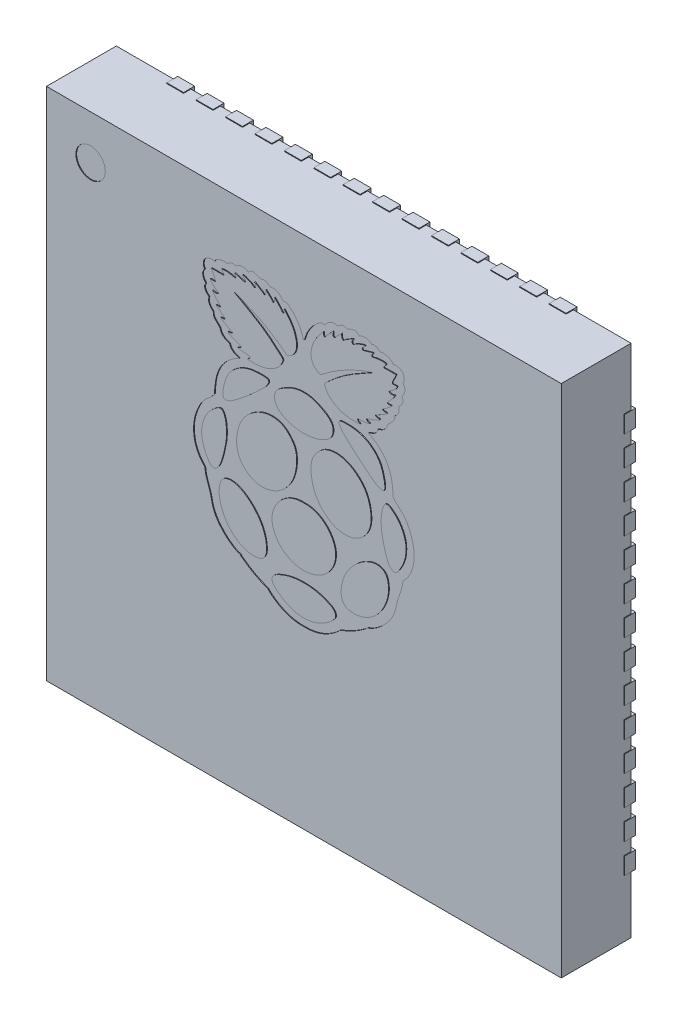
from build123d import *

# Parameters (mm, degrees)
SKETCH1_W                 = 7
SKETCH1_H                 = 7
BOSS_EXTRUDE1_DEPTH       = 1
SKETCH1_4_W               = 7
SKETCH1_4_H               = 7
CUT_EXTRUDE1_DEPTH        = 0.05
WRAP1_START               = -0.01
WRAP1_OUTLINE_R           = 0.2
WRAP1_DEPTH               = 0.01
BOSS_EXTRUDE2_DEPTH       = 0.15
LPATTERN1_COUNT           = 14
LPATTERN1_PITCH           = 0.4
CIRPATTERN1_COUNT         = 4
CIRPATTERN1_COPY_1_DEPTH  = 0.15
CIRPATTERN1_COPY_2_DEPTH  = 0.15
CIRPATTERN1_COPY_3_DEPTH  = 0.15
CIRPATTERN1_COPY_4_DEPTH  = 0.15
CIRPATTERN1_COPY_5_DEPTH  = 0.15
CIRPATTERN1_COPY_6_DEPTH  = 0.15
CIRPATTERN1_COPY_7_DEPTH  = 0.15
CIRPATTERN1_COPY_8_DEPTH  = 0.15
CIRPATTERN1_COPY_9_DEPTH  = 0.15
CIRPATTERN1_COPY_10_DEPTH = 0.15
CIRPATTERN1_COPY_11_DEPTH = 0.15
CIRPATTERN1_COPY_12_DEPTH = 0.15
CIRPATTERN1_COPY_13_DEPTH = 0.15
CIRPATTERN1_COPY_14_DEPTH = 0.15
CIRPATTERN1_COPY_15_DEPTH = 0.15
CIRPATTERN1_COPY_16_DEPTH = 0.15
CIRPATTERN1_COPY_17_DEPTH = 0.15
CIRPATTERN1_COPY_18_DEPTH = 0.15
CIRPATTERN1_COPY_19_DEPTH = 0.15
CIRPATTERN1_COPY_20_DEPTH = 0.15
CIRPATTERN1_COPY_21_DEPTH = 0.15
CIRPATTERN1_COPY_22_DEPTH = 0.15
CIRPATTERN1_COPY_23_DEPTH = 0.15
CIRPATTERN1_COPY_24_DEPTH = 0.15
CIRPATTERN1_COPY_25_DEPTH = 0.15
CIRPATTERN1_COPY_26_DEPTH = 0.15
CIRPATTERN1_COPY_27_DEPTH = 0.15
CIRPATTERN1_COPY_28_DEPTH = 0.15
CIRPATTERN1_COPY_29_DEPTH = 0.15
CIRPATTERN1_COPY_30_DEPTH = 0.15
CIRPATTERN1_COPY_31_DEPTH = 0.15
CIRPATTERN1_COPY_32_DEPTH = 0.15
CIRPATTERN1_COPY_33_DEPTH = 0.15
CIRPATTERN1_COPY_34_DEPTH = 0.15
CIRPATTERN1_COPY_35_DEPTH = 0.15
CIRPATTERN1_COPY_36_DEPTH = 0.15
CIRPATTERN1_COPY_37_DEPTH = 0.15
CIRPATTERN1_COPY_38_DEPTH = 0.15
CIRPATTERN1_COPY_39_DEPTH = 0.15
BOSS_EXTRUDE3_DEPTH       = 0.05


# Read off the part's stored shape, not the designer's step: Wrap1
with BuildPart() as part:
    # Sketch1 → Boss-Extrude1 (new body)
    with BuildSketch(Plane.XY):
        Rectangle(SKETCH1_W, SKETCH1_H)
    extrude(amount=BOSS_EXTRUDE1_DEPTH)

    # Sketch1<4> → Cut-Extrude1 (cut)
    with BuildSketch(Plane.XY):
        Rectangle(SKETCH1_4_W, SKETCH1_4_H)
    extrude(amount=CUT_EXTRUDE1_DEPTH, mode=Mode.SUBTRACT)

    # Wrap1 outline → Wrap1 (cut)
    # profile 1 of 2: a face of its own
    with BuildSketch(Plane.XY.offset(1).offset(WRAP1_START)):
        with BuildLine():
            add(Edge.make_bspline(
                [(0, 2.263868394), (-0.000237821, 2.263988796), (-0.009075366, 2.264963574), (-0.012945677, 2.28180384), (-0.043625306, 2.395157437), (-0.141319772, 2.512017758), (-0.13635276, 2.504435025), (-0.194166588, 2.561981979), (-0.233115268, 2.582744886), (-0.254894364, 2.58781046), (-0.283447361, 2.579723211), (-0.293929284, 2.5974559), (-0.31048703, 2.61570591), (-0.318377963, 2.622126585), (-0.336821248, 2.640155859), (-0.361566116, 2.652541494), (-0.376583272, 2.658425788), (-0.395633183, 2.665798558), (-0.437797963, 2.664301581), (-0.440118612, 2.655192025), (-0.46921817, 2.665395191), (-0.479871951, 2.675708489), (-0.506284686, 2.693046871), (-0.535137006, 2.701340793), (-0.552129951, 2.699103027), (-0.567212348, 2.694821527), (-0.588210152, 2.688184658), (-0.61004655, 2.692240757), (-0.62842033, 2.707072221), (-0.652301945, 2.714789305), (-0.678770517, 2.71653393), (-0.693501407, 2.728138313), (-0.726188853, 2.710078323), (-0.745292698, 2.698269963), (-0.752604228, 2.684685375), (-0.770149642, 2.695516983), (-0.810781494, 2.712947906), (-0.828036794, 2.703946281), (-0.85279431, 2.711390266), (-0.890559096, 2.697736765), (-0.914571037, 2.681870808), (-0.921221254, 2.670832962), (-0.930681967, 2.675154966), (-0.937185658, 2.678638895), (-0.956793571, 2.681497479), (-0.988116752, 2.676099863), (-0.997350133, 2.67222525), (-1.021303652, 2.659987036), (-1.033745867, 2.642860774), (-1.052131869, 2.642115595), (-1.056733903, 2.645030417), (-1.064601481, 2.650757521), (-1.083547885, 2.647087463), (-1.103091742, 2.643858941), (-1.097155115, 2.646252489), (-1.136597298, 2.640489907), (-1.172528357, 2.624140858), (-1.200178438, 2.609970685), (-1.207197282, 2.594434597), (-1.213154387, 2.583404699), (-1.238801596, 2.590329305), (-1.28222102, 2.586424918), (-1.301636295, 2.578293763), (-1.327857828, 2.566095655), (-1.343257887, 2.552083748), (-1.359766555, 2.524660663), (-1.366104219, 2.502070233), (-1.36431879, 2.44462577), (-1.348865083, 2.429221336), (-1.350245079, 2.418236266), (-1.357634287, 2.409247222), (-1.367167479, 2.396088075), (-1.374797688, 2.374813102), (-1.376525098, 2.356914978), (-1.366771465, 2.31177959), (-1.357485344, 2.300382973), (-1.346172354, 2.281629438), (-1.330566569, 2.257185809), (-1.348107151, 2.242939318), (-1.352151795, 2.21647816), (-1.338024847, 2.177158458), (-1.316561423, 2.151881982), (-1.30254943, 2.139409346), (-1.29370493, 2.12966458), (-1.286252195, 2.123872757), (-1.291466811, 2.126272952), (-1.295003854, 2.088943824), (-1.291953479, 2.047360608), (-1.270765122, 2.017155092), (-1.236508115, 1.983768537), (-1.226111926, 1.982695351), (-1.233977647, 1.956044911), (-1.219907274, 1.91651789), (-1.205121975, 1.901729915), (-1.178689977, 1.874945904), (-1.137299812, 1.836663638), (-1.134297422, 1.815497868), (-1.124236292, 1.791543277), (-1.11779475, 1.782106183), (-1.097387248, 1.758374331), (-1.078314913, 1.746418462), (-1.070348233, 1.739864174), (-1.029792354, 1.722048335), (-1.012002743, 1.718649509), (-1.006781202, 1.713616191), (-1.001472674, 1.695337281), (-0.998493799, 1.686055382), (-0.987667188, 1.670565142), (-0.974088499, 1.653934889), (-0.94971148, 1.637270374), (-0.91086471, 1.621705284), (-0.903709179, 1.621199235), (-0.874006313, 1.609522827), (-0.949686956, 1.569589166), (-1.016293053, 1.520040427), (-1.058917183, 1.476174679), (-1.101231651, 1.430363577), (-1.131260362, 1.383400135), (-1.182267256, 1.278676023), (-1.201028818, 1.197588845), (-1.214007102, 1.059972921), (-1.209853934, 1.026067695), (-1.231089628, 0.995630059), (-1.274155722, 0.947912237), (-1.369743629, 0.878205197), (-1.44921421, 0.731968927), (-1.529296604, 0.47465884), (-1.475757946, 0.219780431), (-1.343913741, 0.096978345), (-1.337606042, -0.020245899), (-1.275116309, -0.126690919), (-1.250841145, -0.284953623), (-1.208023351, -0.405498638), (-1.10133956, -0.544820872), (-0.985019233, -0.641505904), (-0.899837205, -0.684446239), (-0.869205377, -0.691176819), (-0.851618912, -0.712118946), (-0.81854871, -0.73491996), (-0.769330282, -0.769927336), (-0.69196638, -0.820673366), (-0.600677542, -0.866842882), (-0.523466343, -0.898110105), (-0.489651838, -0.910697507), (-0.449757183, -0.954747695), (-0.390921249, -0.997054094), (-0.297990262, -1.05213429), (-0.179031081, -1.102092447), (-0.068764025, -1.115463523), (0, -1.112662139)],
                knots=[0, 0, 0, 0, 0.001900291, 0.002584691, 0.003843042, 0.023580722, 0.036045596, 0.052346293, 0.057185764, 0.061235409, 0.063231459, 0.064667643, 0.066784773, 0.069273202, 0.072185191, 0.075187351, 0.078809585, 0.082400045, 0.086051364, 0.08888384, 0.090784678, 0.094268595, 0.098665045, 0.102667824, 0.105704606, 0.108516071, 0.111229292, 0.112119566, 0.115681304, 0.120110402, 0.12274182, 0.12592397, 0.128115227, 0.131986193, 0.135578493, 0.136847986, 0.142481505, 0.146435775, 0.150468854, 0.152042347, 0.157607107, 0.160024983, 0.160368889, 0.162208965, 0.167306561, 0.169261352, 0.171845021, 0.174864158, 0.177676096, 0.179020491, 0.181965713, 0.184813575, 0.185526527, 0.18601189, 0.189206279, 0.190796332, 0.192248095, 0.195217366, 0.20478082, 0.205221654, 0.205437557, 0.206626447, 0.211935744, 0.21619854, 0.22472088, 0.232451198, 0.238461167, 0.241117898, 0.24157737, 0.242225607, 0.243733091, 0.245473461, 0.247613706, 0.251185055, 0.256063659, 0.263766058, 0.266039767, 0.266486209, 0.268360127, 0.274247011, 0.279659646, 0.283762891, 0.286861923, 0.287819324, 0.288866577, 0.296294981, 0.29959124, 0.302294002, 0.310760701, 0.311266772, 0.31166935, 0.314016333, 0.317561091, 0.325031272, 0.331992342, 0.335112927, 0.338819169, 0.342140221, 0.345247144, 0.347815807, 0.351550013, 0.357123841, 0.359317349, 0.360959262, 0.362099574, 0.363390464, 0.36569942, 0.368940794, 0.372518092, 0.377094444, 0.381031411, 0.385193158, 0.386224874, 0.387467602, 0.39393445, 0.407282794, 0.411458552, 0.432999424, 0.442172302, 0.494014449, 0.501132878, 0.506876327, 0.51030105, 0.518847019, 0.538922233, 0.567744448, 0.598820024, 0.672572958, 0.678783832, 0.683964663, 0.728334155, 0.738200334, 0.76285999, 0.790528128, 0.824028352, 0.836268966, 0.837918239, 0.838903934, 0.849482332, 0.857732907, 0.868746728, 0.895186067, 0.9078897, 0.910243551, 0.91271422, 0.936762579, 0.945908598, 0.966070072, 1, 1, 1, 1], degree=3))
            add(Edge.make_bspline(
                [(0, -1.112662139), (0.068764025, -1.115463523), (0.179031081, -1.102092447), (0.297990262, -1.05213429), (0.390921249, -0.997054094), (0.449757183, -0.954747695), (0.489651838, -0.910697507), (0.523466343, -0.898110105), (0.600677542, -0.866842882), (0.69196638, -0.820673366), (0.769330282, -0.769927336), (0.81854871, -0.73491996), (0.851618912, -0.712118946), (0.869205377, -0.691176819), (0.899837205, -0.684446239), (0.985019233, -0.641505904), (1.10133956, -0.544820872), (1.208023351, -0.405498638), (1.250841145, -0.284953623), (1.275116309, -0.126690919), (1.337606042, -0.020245899), (1.343913741, 0.096978345), (1.475757946, 0.219780431), (1.529296604, 0.47465884), (1.44921421, 0.731968927), (1.369743629, 0.878205197), (1.274155722, 0.947912237), (1.231089628, 0.995630059), (1.209853934, 1.026067695), (1.214007102, 1.059972921), (1.201028818, 1.197588845), (1.182267256, 1.278676023), (1.131260362, 1.383400135), (1.101231651, 1.430363577), (1.058917183, 1.476174679), (1.016293053, 1.520040427), (0.949686956, 1.569589166), (0.874006313, 1.609522827), (0.903709179, 1.621199235), (0.91086471, 1.621705284), (0.94971148, 1.637270374), (0.974088499, 1.653934889), (0.987667188, 1.670565142), (0.998493799, 1.686055382), (1.001472674, 1.695337281), (1.006781202, 1.713616191), (1.012002743, 1.718649509), (1.029792354, 1.722048335), (1.070348233, 1.739864174), (1.078314913, 1.746418462), (1.097387248, 1.758374331), (1.11779475, 1.782106183), (1.124236292, 1.791543277), (1.134297422, 1.815497868), (1.137299812, 1.836663638), (1.178689977, 1.874945904), (1.205121975, 1.901729915), (1.219907274, 1.91651789), (1.233977647, 1.956044911), (1.226111926, 1.982695351), (1.236508115, 1.983768537), (1.270765122, 2.017155092), (1.291953479, 2.047360608), (1.295003854, 2.088943824), (1.291466811, 2.126272952), (1.286252195, 2.123872757), (1.29370493, 2.12966458), (1.30254943, 2.139409346), (1.316561423, 2.151881982), (1.338024847, 2.177158458), (1.352151795, 2.21647816), (1.348107151, 2.242939318), (1.330566569, 2.257185809), (1.346172354, 2.281629438), (1.357485344, 2.300382973), (1.366771465, 2.31177959), (1.376525098, 2.356914978), (1.374797688, 2.374813102), (1.367167479, 2.396088075), (1.357634287, 2.409247222), (1.350245079, 2.418236266), (1.348865083, 2.429221336), (1.36431879, 2.44462577), (1.366104219, 2.502070233), (1.359766555, 2.524660663), (1.343257887, 2.552083748), (1.327857828, 2.566095655), (1.301636295, 2.578293763), (1.28222102, 2.586424918), (1.238801596, 2.590329305), (1.213154387, 2.583404699), (1.207197282, 2.594434597), (1.200178438, 2.609970685), (1.172528357, 2.624140858), (1.136597298, 2.640489907), (1.097155115, 2.646252489), (1.103091742, 2.643858941), (1.083547885, 2.647087463), (1.064601481, 2.650757521), (1.056733903, 2.645030417), (1.052131869, 2.642115595), (1.033745867, 2.642860774), (1.021303652, 2.659987036), (0.997350133, 2.67222525), (0.988116752, 2.676099863), (0.956793571, 2.681497479), (0.937185658, 2.678638895), (0.930681967, 2.675154966), (0.921221254, 2.670832962), (0.914571037, 2.681870808), (0.890559096, 2.697736765), (0.85279431, 2.711390266), (0.828036794, 2.703946281), (0.810781494, 2.712947906), (0.770149642, 2.695516983), (0.752604228, 2.684685375), (0.745292698, 2.698269963), (0.726188853, 2.710078323), (0.693501407, 2.728138313), (0.678770517, 2.71653393), (0.652301945, 2.714789305), (0.62842033, 2.707072221), (0.61004655, 2.692240757), (0.588210152, 2.688184658), (0.567212348, 2.694821527), (0.552129951, 2.699103027), (0.535137006, 2.701340793), (0.506284686, 2.693046871), (0.479871951, 2.675708489), (0.46921817, 2.665395191), (0.440118612, 2.655192025), (0.437797963, 2.664301581), (0.395633183, 2.665798558), (0.376583272, 2.658425788), (0.361566116, 2.652541494), (0.336821248, 2.640155859), (0.318377963, 2.622126585), (0.31048703, 2.61570591), (0.293929284, 2.5974559), (0.283447361, 2.579723211), (0.254894364, 2.58781046), (0.233115268, 2.582744886), (0.194166588, 2.561981979), (0.13635276, 2.504435025), (0.141319772, 2.512017758), (0.043625306, 2.395157437), (0.012945677, 2.28180384), (0.009075366, 2.264963574), (0.000237821, 2.263988796), (0, 2.263868394)],
                knots=[0, 0, 0, 0, 0.033929928, 0.054091402, 0.063237421, 0.08728578, 0.089756449, 0.0921103, 0.104813933, 0.131253272, 0.142267093, 0.150517668, 0.161096066, 0.162081761, 0.163731034, 0.175971648, 0.209471872, 0.23714001, 0.261799666, 0.271665845, 0.316035337, 0.321216168, 0.327427042, 0.401179976, 0.432255552, 0.461077767, 0.481152981, 0.48969895, 0.493123673, 0.498867122, 0.505985551, 0.557827698, 0.567000576, 0.588541448, 0.592717206, 0.60606555, 0.612532398, 0.613775126, 0.614806842, 0.618968589, 0.622905556, 0.627481908, 0.631059206, 0.63430058, 0.636609536, 0.637900426, 0.639040738, 0.640682651, 0.642876159, 0.648449987, 0.652184193, 0.654752856, 0.657859779, 0.661180831, 0.664887073, 0.668007658, 0.674968728, 0.682438909, 0.685983667, 0.68833065, 0.688733228, 0.689239299, 0.697705998, 0.70040876, 0.703705019, 0.711133423, 0.712180676, 0.713138077, 0.716237109, 0.720340354, 0.725752989, 0.731639873, 0.733513791, 0.733960233, 0.736233942, 0.743936341, 0.748814945, 0.752386294, 0.754526539, 0.756266909, 0.757774393, 0.75842263, 0.758882102, 0.761538833, 0.767548802, 0.77527912, 0.78380146, 0.788064256, 0.793373553, 0.794562443, 0.794778346, 0.79521918, 0.804782634, 0.807751905, 0.809203668, 0.810793721, 0.81398811, 0.814473473, 0.815186425, 0.818034287, 0.820979509, 0.822323904, 0.825135842, 0.828154979, 0.830738648, 0.832693439, 0.837791035, 0.839631111, 0.839975017, 0.842392893, 0.847957653, 0.849531146, 0.853564225, 0.857518495, 0.863152014, 0.864421507, 0.868013807, 0.871884773, 0.87407603, 0.87725818, 0.879889598, 0.884318696, 0.887880434, 0.888770708, 0.891483929, 0.894295394, 0.897332176, 0.901334955, 0.905731405, 0.909215322, 0.91111616, 0.913948636, 0.917599955, 0.921190415, 0.924812649, 0.927814809, 0.930726798, 0.933215227, 0.935332357, 0.936768541, 0.938764591, 0.942814236, 0.947653707, 0.963954404, 0.976419278, 0.996156958, 0.997415309, 0.998099709, 1, 1, 1, 1], degree=3))
        make_face()
        with BuildLine():
            add(Edge.make_bspline(
                [(-0.531515197, -0.297651942), (-0.543543432, -0.259370555), (-0.577069278, -0.180388075), (-0.644693864, -0.08734762), (-0.736792822, 0.007103231), (-0.833159448, 0.076500682), (-0.94667835, 0.115276878), (-1.035916644, 0.117375088), (-1.122992708, 0.070195823), (-1.148251718, -0.019622291), (-1.15810035, -0.147581539), (-1.114748121, -0.30421543), (-1.003778414, -0.485896724), (-0.846609353, -0.594051168), (-0.703306569, -0.623044086), (-0.619776045, -0.614682235), (-0.553226147, -0.592734366), (-0.508924854, -0.525176289), (-0.502324523, -0.420627754), (-0.517434866, -0.342464385), (-0.531515197, -0.297651942)],
                knots=[0, 0, 0, 0, 0.055870822, 0.118870956, 0.159068405, 0.239979588, 0.28134836, 0.325123552, 0.361044344, 0.410312217, 0.445863072, 0.541403845, 0.629333197, 0.739921879, 0.795425324, 0.829580463, 0.856809559, 0.889825811, 0.934597249, 1, 1, 1, 1], degree=3))
        make_face(mode=Mode.SUBTRACT)
        with BuildLine():
            add(Edge.make_bspline(
                [(-1.090644048, 0.377522908), (-1.074285401, 0.442659223), (-1.044609409, 0.577932361), (-1.050086185, 0.747860906), (-1.081829502, 0.850889106), (-1.113561365, 0.895223877), (-1.15616414, 0.891370436), (-1.201737491, 0.859280938), (-1.26585247, 0.807947611), (-1.333820533, 0.715057545), (-1.393600733, 0.575123927), (-1.392718807, 0.38848051), (-1.329323494, 0.243275776), (-1.263990479, 0.148500489), (-1.213772928, 0.142598533), (-1.167925828, 0.171235832), (-1.123266572, 0.254570264), (-1.102057885, 0.332075674), (-1.090644048, 0.377522908)],
                knots=[0, 0, 0, 0, 0.116420494, 0.239674936, 0.286793958, 0.305267853, 0.326896757, 0.351294306, 0.402423018, 0.468070765, 0.54858081, 0.663133905, 0.775877559, 0.831292747, 0.840399115, 0.860618206, 0.918770515, 1, 1, 1, 1], degree=3))
        make_face(mode=Mode.SUBTRACT)
        with BuildLine():
            add(Edge.make_bspline(
                [(0, -1.012050226), (0.089927248, -1.014001512), (0.233370228, -0.967301928), (0.369735263, -0.871531667), (0.44209674, -0.789964282), (0.419201952, -0.71075274), (0.263079789, -0.624901123), (0.121360151, -0.59567764), (0, -0.596815113)],
                knots=[0, 0, 0, 0, 0.267268042, 0.421318846, 0.517025164, 0.544466299, 0.654200027, 1, 1, 1, 1], degree=3))
            add(Edge.make_bspline(
                [(0, -0.596815113), (-0.121360151, -0.59567764), (-0.263079789, -0.624901123), (-0.419201952, -0.71075274), (-0.44209674, -0.789964282), (-0.369735263, -0.871531667), (-0.233370228, -0.967301928), (-0.089927248, -1.014001512), (0, -1.012050226)],
                knots=[0, 0, 0, 0, 0.345799973, 0.455533701, 0.482974836, 0.578681154, 0.732731958, 1, 1, 1, 1], degree=3))
        make_face(mode=Mode.SUBTRACT)
        with BuildLine():
            add(Edge.make_bspline(
                [(0.531515197, -0.297651942), (0.517434866, -0.342464385), (0.502324523, -0.420627754), (0.508924854, -0.525176289), (0.553226147, -0.592734366), (0.619776045, -0.614682235), (0.703306569, -0.623044086), (0.846609353, -0.594051168), (1.003778414, -0.485896724), (1.114748121, -0.30421543), (1.15810035, -0.147581539), (1.148251718, -0.019622291), (1.122992708, 0.070195823), (1.035916644, 0.117375088), (0.94667835, 0.115276878), (0.833159448, 0.076500682), (0.736792822, 0.007103231), (0.644693864, -0.08734762), (0.577069278, -0.180388075), (0.543543432, -0.259370555), (0.531515197, -0.297651942)],
                knots=[0, 0, 0, 0, 0.065402751, 0.110174189, 0.143190441, 0.170419537, 0.204574676, 0.260078121, 0.370666803, 0.458596155, 0.554136928, 0.589687783, 0.638955656, 0.674876448, 0.71865164, 0.760020412, 0.840931595, 0.881129044, 0.944129178, 1, 1, 1, 1], degree=3))
        make_face(mode=Mode.SUBTRACT)
        with BuildLine():
            add(Edge.make_bspline(
                [(0, -0.455059026), (0.08979737, -0.451289117), (0.251268571, -0.406059257), (0.402043296, -0.234605961), (0.450037987, -0.045757123), (0.394941445, 0.129131806), (0.25379809, 0.295477961), (0.097752415, 0.34952134), (0, 0.342542534)],
                knots=[0, 0, 0, 0, 0.209548183, 0.368426031, 0.50683945, 0.64131966, 0.776300843, 1, 1, 1, 1], degree=3))
            add(Edge.make_bspline(
                [(0, 0.342542534), (-0.097752415, 0.34952134), (-0.25379809, 0.295477961), (-0.394941445, 0.129131806), (-0.450037987, -0.045757123), (-0.402043296, -0.234605961), (-0.251268571, -0.406059257), (-0.08979737, -0.451289117), (0, -0.455059026)],
                knots=[0, 0, 0, 0, 0.223699157, 0.35868034, 0.49316055, 0.631573969, 0.790451817, 1, 1, 1, 1], degree=3))
        make_face(mode=Mode.SUBTRACT)
        with BuildLine():
            add(Edge.make_bspline(
                [(-0.189095095, 1.036344232), (-0.209503755, 1.059477517), (-0.264926623, 1.113521864), (-0.395651543, 1.157600049), (-0.55707909, 1.139226168), (-0.722141769, 1.051324575), (-0.852066054, 0.908115969), (-0.918901369, 0.70148681), (-0.920967041, 0.468479656), (-0.764922036, 0.290643703), (-0.56764745, 0.235435321), (-0.334382369, 0.290792952), (-0.140347201, 0.498242107), (-0.089530282, 0.741516294), (-0.104374902, 0.924859525), (-0.159118674, 1.002365857), (-0.189095095, 1.036344232)],
                knots=[0, 0, 0, 0, 0.034249796, 0.086381331, 0.148490656, 0.211762113, 0.293385027, 0.358085361, 0.453756871, 0.540429687, 0.601769765, 0.676182365, 0.798958217, 0.89645744, 0.949693595, 1, 1, 1, 1], degree=3))
        make_face(mode=Mode.SUBTRACT)
        with BuildLine():
            add(Edge.make_bspline(
                [(0.189095095, 1.036344232), (0.159118674, 1.002365857), (0.104374902, 0.924859525), (0.089530282, 0.741516294), (0.140347201, 0.498242107), (0.334382369, 0.290792952), (0.56764745, 0.235435321), (0.764922036, 0.290643703), (0.920967041, 0.468479656), (0.918901369, 0.70148681), (0.852066054, 0.908115969), (0.722141769, 1.051324575), (0.55707909, 1.139226168), (0.395651543, 1.157600049), (0.264926623, 1.113521864), (0.209503755, 1.059477517), (0.189095095, 1.036344232)],
                knots=[0, 0, 0, 0, 0.050306405, 0.10354256, 0.201041783, 0.323817635, 0.398230235, 0.459570313, 0.546243129, 0.641914639, 0.706614973, 0.788237887, 0.851509344, 0.913618669, 0.965750204, 1, 1, 1, 1], degree=3))
        make_face(mode=Mode.SUBTRACT)
        with BuildLine():
            add(Edge.make_bspline(
                [(1.090644048, 0.377522908), (1.102057885, 0.332075674), (1.123266572, 0.254570264), (1.167925828, 0.171235832), (1.213772928, 0.142598533), (1.263990479, 0.148500489), (1.329323494, 0.243275776), (1.392718807, 0.38848051), (1.393600733, 0.575123927), (1.333820533, 0.715057545), (1.26585247, 0.807947611), (1.201737491, 0.859280938), (1.15616414, 0.891370436), (1.113561365, 0.895223877), (1.081829502, 0.850889106), (1.050086185, 0.747860906), (1.044609409, 0.577932361), (1.074285401, 0.442659223), (1.090644048, 0.377522908)],
                knots=[0, 0, 0, 0, 0.081229485, 0.139381794, 0.159600885, 0.168707253, 0.224122441, 0.336866095, 0.45141919, 0.531929235, 0.597576982, 0.648705694, 0.673103243, 0.694732147, 0.713206042, 0.760325064, 0.883579506, 1, 1, 1, 1], degree=3))
        make_face(mode=Mode.SUBTRACT)
        with BuildLine():
            add(Edge.make_bspline(
                [(-0.611758378, 1.564830674), (-0.662943254, 1.563253399), (-0.778843652, 1.549146371), (-0.927915521, 1.471020224), (-1.025989636, 1.360701447), (-1.070285808, 1.254530862), (-1.091617805, 1.17041437), (-1.102179575, 1.097775036), (-1.103092218, 1.045494493), (-1.078490928, 1.027025591), (-1.056452718, 1.027650636), (-0.999778322, 1.040812446), (-0.820055853, 1.173910603), (-0.642597265, 1.327527411), (-0.490244112, 1.481164618), (-0.47442421, 1.532396424), (-0.4826459, 1.554624881), (-0.515524541, 1.563044511), (-0.557752949, 1.565329717), (-0.593103582, 1.565405526), (-0.611758378, 1.564830674)],
                knots=[0, 0, 0, 0, 0.086099601, 0.195697192, 0.276201444, 0.330060105, 0.38947374, 0.420015151, 0.460009334, 0.461401675, 0.471534779, 0.494356599, 0.561281027, 0.837915457, 0.904950352, 0.915880338, 0.926548854, 0.940617232, 0.968620212, 1, 1, 1, 1], degree=3))
        make_face(mode=Mode.SUBTRACT)
        with BuildLine():
            add(Edge.make_bspline(
                [(0, 1.161852115), (0.097452841, 1.164640907), (0.241705853, 1.188929933), (0.398343268, 1.310249329), (0.406316181, 1.478635837), (0.227228525, 1.594570449), (0.092725149, 1.646978174), (0, 1.643273856)],
                knots=[0, 0, 0, 0, 0.287599285, 0.438955045, 0.54387233, 0.737139189, 1, 1, 1, 1], degree=3))
            add(Edge.make_bspline(
                [(0, 1.643273856), (-0.092725149, 1.646978174), (-0.227228525, 1.594570449), (-0.406316181, 1.478635837), (-0.398343268, 1.310249329), (-0.241705853, 1.188929933), (-0.097452841, 1.164640907), (0, 1.161852115)],
                knots=[0, 0, 0, 0, 0.262860811, 0.45612767, 0.561044955, 0.712400715, 1, 1, 1, 1], degree=3))
        make_face(mode=Mode.SUBTRACT)
        with BuildLine():
            add(Edge.make_bspline(
                [(0.611758378, 1.564830674), (0.593103582, 1.565405526), (0.557752949, 1.565329717), (0.515524541, 1.563044511), (0.4826459, 1.554624881), (0.47442421, 1.532396424), (0.490244112, 1.481164618), (0.642597265, 1.327527411), (0.820055853, 1.173910603), (0.999778322, 1.040812446), (1.056452718, 1.027650636), (1.078490928, 1.027025591), (1.103092218, 1.045494493), (1.102179575, 1.097775036), (1.091617805, 1.17041437), (1.070285808, 1.254530862), (1.025989636, 1.360701447), (0.927915521, 1.471020224), (0.778843652, 1.549146371), (0.662943254, 1.563253399), (0.611758378, 1.564830674)],
                knots=[0, 0, 0, 0, 0.031379788, 0.059382768, 0.073451146, 0.084119662, 0.095049648, 0.162084543, 0.438718973, 0.505643401, 0.528465221, 0.538598325, 0.539990666, 0.579984849, 0.61052626, 0.669939895, 0.723798556, 0.804302808, 0.913900399, 1, 1, 1, 1], degree=3))
        make_face(mode=Mode.SUBTRACT)
        with BuildLine():
            add(Edge.make_bspline(
                [(-0.224177318, 1.964914289), (-0.197922727, 1.977857565), (-0.149618765, 2.003026982), (-0.110546147, 2.066325376), (-0.093084341, 2.132605387), (-0.101438683, 2.206170516), (-0.134814231, 2.324806872), (-0.191010253, 2.404981986), (-0.246682164, 2.472559997), (-0.262719258, 2.493502888), (-0.269460083, 2.492967239), (-0.269086818, 2.477854029), (-0.268617944, 2.465403614), (-0.270647032, 2.45188309), (-0.276021923, 2.440849136), (-0.290475992, 2.442206488), (-0.310679165, 2.472453312), (-0.324269554, 2.487770237), (-0.333361477, 2.496282378), (-0.36446076, 2.532147397), (-0.389480535, 2.553210117), (-0.398888271, 2.56792336), (-0.401824109, 2.553816463), (-0.399451578, 2.54402163), (-0.395837366, 2.52465654), (-0.397602691, 2.514219776), (-0.407101464, 2.500497077), (-0.419001412, 2.497516066), (-0.449914643, 2.536940044), (-0.449017265, 2.533560402), (-0.509758196, 2.589693087), (-0.510912477, 2.595035969), (-0.520812563, 2.592993727), (-0.51132734, 2.576736471), (-0.512322184, 2.570879545), (-0.517210684, 2.549004037), (-0.528117092, 2.527699748), (-0.542190906, 2.526163847), (-0.553127136, 2.541058886), (-0.583054961, 2.560022274), (-0.617824358, 2.581583858), (-0.648938515, 2.600368478), (-0.663218475, 2.605950379), (-0.672522276, 2.609696265), (-0.675487306, 2.60468115), (-0.67331407, 2.59950971), (-0.666786097, 2.593831796), (-0.659049109, 2.584051563), (-0.654324795, 2.570466426), (-0.657001972, 2.556863562), (-0.662447187, 2.545993797), (-0.673756795, 2.54332227), (-0.685634749, 2.553526222), (-0.70493781, 2.568122588), (-0.736945479, 2.585970975), (-0.767900953, 2.595427012), (-0.792537695, 2.60697328), (-0.812446371, 2.61020445), (-0.825511364, 2.61425925), (-0.836394512, 2.611427377), (-0.82908743, 2.601560008), (-0.819162167, 2.594667537), (-0.806753054, 2.580735073), (-0.793615301, 2.570477651), (-0.79314388, 2.556593541), (-0.798969966, 2.543080577), (-0.817175839, 2.545134677), (-0.840946236, 2.553027862), (-0.879922063, 2.563615621), (-0.895632961, 2.568081999), (-0.92750333, 2.580062533), (-0.942709896, 2.581507638), (-0.943235221, 2.570714539), (-0.933632227, 2.565297524), (-0.927700519, 2.554833797), (-0.922740825, 2.544576373), (-0.924371585, 2.533055703), (-0.933512221, 2.528314049), (-0.947021119, 2.529009672), (-0.968514548, 2.536699155), (-1.002647184, 2.541948066), (-1.043856419, 2.547141949), (-1.081838866, 2.545989938), (-1.105317037, 2.544365323), (-1.121981391, 2.540618415), (-1.118245276, 2.528096896), (-1.10418065, 2.512536798), (-1.095294188, 2.501441291), (-1.087361546, 2.49315666), (-1.086288516, 2.481196446), (-1.102658626, 2.479505655), (-1.136123022, 2.479885712), (-1.162344589, 2.480416619), (-1.217405203, 2.481025631), (-1.222449768, 2.480185633), (-1.256273331, 2.481766905), (-1.251560315, 2.468364655), (-1.246194015, 2.460260991), (-1.223750997, 2.414373516), (-1.212579497, 2.389172892), (-1.201255781, 2.360665621), (-1.202690276, 2.353329802), (-1.208387535, 2.346922286), (-1.221681828, 2.348272124), (-1.238225452, 2.348933226), (-1.267349641, 2.349947348), (-1.272517913, 2.346090454), (-1.261926862, 2.327449713), (-1.252987684, 2.302410174), (-1.181263595, 2.256047885), (-1.174144382, 2.251218879), (-1.156477861, 2.235121953), (-1.164890697, 2.224754334), (-1.178890913, 2.220122599), (-1.190676484, 2.219024041), (-1.21155102, 2.21989754), (-1.229949412, 2.222284983), (-1.239607237, 2.231912241), (-1.240114082, 2.225728349), (-1.22391264, 2.194796628), (-1.177748043, 2.139611427), (-1.162019832, 2.128707686), (-1.141935584, 2.101966767), (-1.13066488, 2.08638596), (-1.13941496, 2.08187104), (-1.164403961, 2.082195425), (-1.15859903, 2.082003085), (-1.187904562, 2.082885967), (-1.194488378, 2.084290472), (-1.175345546, 2.058651882), (-1.146247137, 2.04634627), (-1.112420824, 2.008109327), (-1.073910839, 1.989881799), (-1.071437208, 1.973861287), (-1.086611294, 1.967254958), (-1.11135891, 1.966552348), (-1.132481207, 1.967212795), (-1.129966357, 1.953550324), (-1.06248169, 1.913924539), (-1.039737477, 1.90246899), (-0.984996684, 1.872716817), (-0.969207323, 1.864113077), (-0.975477235, 1.855910501), (-0.989324163, 1.851168741), (-0.996899629, 1.848405019), (-1.012825644, 1.847930394), (-1.034787322, 1.848716661), (-1.035596224, 1.838226365), (-0.988505464, 1.813827014), (-0.981250721, 1.807841815), (-0.92678181, 1.784577714), (-0.852382759, 1.768514459), (-0.850818501, 1.752142608), (-0.872593156, 1.734028925), (-0.90871645, 1.728351065), (-0.855468197, 1.712878794), (-0.822820758, 1.710300935), (-0.773871578, 1.708908945), (-0.731113825, 1.70468417), (-0.72828332, 1.686753268), (-0.750982518, 1.668248661), (-0.761057713, 1.663994778), (-0.766398481, 1.655025509), (-0.750422508, 1.652374761), (-0.662887657, 1.64904843), (-0.5951092, 1.658543277), (-0.505235452, 1.665360662), (-0.350639333, 1.752946661), (-0.310010896, 1.81952903), (-0.273267139, 1.888314448), (-0.291580895, 1.905838357), (-0.313026506, 1.923830036)],
                knots=[0.138242142, 0.138242142, 0.138242142, 0.138242142, 0.154504235, 0.16692629, 0.177843159, 0.191510002, 0.206999935, 0.244231117, 0.249665107, 0.252476269, 0.253922669, 0.255853741, 0.258965445, 0.261384377, 0.263470813, 0.264602342, 0.267529592, 0.274752344, 0.282525531, 0.288532129, 0.292979552, 0.294857785, 0.295957187, 0.298059603, 0.30135934, 0.304976839, 0.307634399, 0.309410421, 0.311005383, 0.326190312, 0.330569264, 0.333691917, 0.335092335, 0.33715187, 0.341481313, 0.344592099, 0.347280388, 0.348645998, 0.350713898, 0.35678099, 0.368106429, 0.373430148, 0.376056955, 0.377277888, 0.377886817, 0.378755199, 0.38008826, 0.382645641, 0.385533594, 0.387575176, 0.390201166, 0.391624317, 0.393221746, 0.398265935, 0.405262614, 0.412994551, 0.415971675, 0.420184169, 0.423644503, 0.424258687, 0.424972068, 0.428690415, 0.43213413, 0.434900886, 0.437334649, 0.439243606, 0.442087648, 0.445701872, 0.454085233, 0.460590322, 0.464053197, 0.466374414, 0.467048663, 0.469256996, 0.471621005, 0.473687452, 0.475398945, 0.477390621, 0.478605869, 0.482792657, 0.489755914, 0.497484178, 0.505694844, 0.509922449, 0.511458713, 0.513511681, 0.517212954, 0.520320829, 0.52195424, 0.523387159, 0.52491846, 0.529973814, 0.538025072, 0.546939383, 0.553482495, 0.55426138, 0.55495621, 0.559350012, 0.565054499, 0.576071271, 0.578456943, 0.579974354, 0.581931258, 0.58560329, 0.590557116, 0.592498074, 0.593149499, 0.595805615, 0.611014051, 0.616026886, 0.620725744, 0.621998955, 0.623617957, 0.626829077, 0.629288124, 0.631517048, 0.635643171, 0.637246602, 0.637840461, 0.638668733, 0.651521992, 0.662776683, 0.667962921, 0.669668138, 0.671204902, 0.674601598, 0.679085786, 0.680707747, 0.681418586, 0.682713162, 0.692275068, 0.703679411, 0.709952655, 0.711574015, 0.714942974, 0.719478785, 0.722313322, 0.722984402, 0.737073049, 0.750755404, 0.755855886, 0.757661067, 0.758861587, 0.761603806, 0.766268164, 0.769194838, 0.769879266, 0.773685429, 0.775096977, 0.783006101, 0.78550139, 0.799061225, 0.80274874, 0.810558175, 0.813852748, 0.822514603, 0.836462089, 0.848543153, 0.855578707, 0.859183632, 0.862579537, 0.868657605, 0.869991673, 0.871281483, 0.888185671, 0.893960171, 0.929026486, 0.960751694, 0.979192495, 0.987209413, 1, 1, 1, 1], degree=3))
            add(Edge.make_bspline(
                [(-0.945842707, 2.351662368), (-0.544365946, 2.225078792), (-0.224177318, 1.964914289)],
                knots=[0, 0, 0, 1, 1, 1], degree=2))
            add(Edge.make_bspline(
                [(-0.313026506, 1.923830036), (-0.375534447, 1.979857761), (-0.576463282, 2.156328132), (-0.801357025, 2.267206874), (-0.945842707, 2.351662368)],
                knots=[0, 0, 0, 0, 0.350069414, 1, 1, 1, 1], degree=3))
        make_face(mode=Mode.SUBTRACT)
        with BuildLine():
            add(Edge.make_bspline(
                [(0.945842707, 2.351662368), (0.801357025, 2.267206874), (0.576463282, 2.156328132), (0.375534447, 1.979857761), (0.313026506, 1.923830036)],
                knots=[0, 0, 0, 0, 0.649930586, 1, 1, 1, 1], degree=3))
            add(Edge.make_bspline(
                [(0.224177318, 1.964914289), (0.544365946, 2.225078792), (0.945842707, 2.351662368)],
                knots=[0, 0, 0, 1, 1, 1], degree=2))
            add(Edge.make_bspline(
                [(0.313026506, 1.923830036), (0.291580895, 1.905838357), (0.273267139, 1.888314448), (0.310010896, 1.81952903), (0.350639333, 1.752946661), (0.505235452, 1.665360662), (0.5951092, 1.658543277), (0.662887657, 1.64904843), (0.750422508, 1.652374761), (0.766398481, 1.655025509), (0.761057713, 1.663994778), (0.750982518, 1.668248661), (0.72828332, 1.686753268), (0.731113825, 1.70468417), (0.773871578, 1.708908945), (0.822820758, 1.710300935), (0.855468197, 1.712878794), (0.90871645, 1.728351065), (0.872593156, 1.734028925), (0.850818501, 1.752142608), (0.852382759, 1.768514459), (0.92678181, 1.784577714), (0.981250721, 1.807841815), (0.988505464, 1.813827014), (1.035596224, 1.838226365), (1.034787322, 1.848716661), (1.012825644, 1.847930394), (0.996899629, 1.848405019), (0.989324163, 1.851168741), (0.975477235, 1.855910501), (0.969207323, 1.864113077), (0.984996684, 1.872716817), (1.039737477, 1.90246899), (1.06248169, 1.913924539), (1.129966357, 1.953550324), (1.132481207, 1.967212795), (1.11135891, 1.966552348), (1.086611294, 1.967254958), (1.071437208, 1.973861287), (1.073910839, 1.989881799), (1.112420824, 2.008109327), (1.146247137, 2.04634627), (1.175345546, 2.058651882), (1.194488378, 2.084290472), (1.187904562, 2.082885967), (1.15859903, 2.082003085), (1.164403961, 2.082195425), (1.13941496, 2.08187104), (1.13066488, 2.08638596), (1.141935584, 2.101966767), (1.162019832, 2.128707686), (1.177748043, 2.139611427), (1.22391264, 2.194796628), (1.240114082, 2.225728349), (1.239607237, 2.231912241), (1.229949412, 2.222284983), (1.21155102, 2.21989754), (1.190676484, 2.219024041), (1.178890913, 2.220122599), (1.164890697, 2.224754334), (1.156477861, 2.235121953), (1.174144382, 2.251218879), (1.181263595, 2.256047885), (1.252987684, 2.302410174), (1.261926862, 2.327449713), (1.272517913, 2.346090454), (1.267349641, 2.349947348), (1.238225452, 2.348933226), (1.221681828, 2.348272124), (1.208387535, 2.346922286), (1.202690276, 2.353329802), (1.201255781, 2.360665621), (1.212579497, 2.389172892), (1.223750997, 2.414373516), (1.246194015, 2.460260991), (1.251560315, 2.468364655), (1.256273331, 2.481766905), (1.222449768, 2.480185633), (1.217405203, 2.481025631), (1.162344589, 2.480416619), (1.136123022, 2.479885712), (1.102658626, 2.479505655), (1.086288516, 2.481196446), (1.087361546, 2.49315666), (1.095294188, 2.501441291), (1.10418065, 2.512536798), (1.118245276, 2.528096896), (1.121981391, 2.540618415), (1.105317037, 2.544365323), (1.081838866, 2.545989938), (1.043856419, 2.547141949), (1.002647184, 2.541948066), (0.968514548, 2.536699155), (0.947021119, 2.529009672), (0.933512221, 2.528314049), (0.924371585, 2.533055703), (0.922740825, 2.544576373), (0.927700519, 2.554833797), (0.933632227, 2.565297524), (0.943235221, 2.570714539), (0.942709896, 2.581507638), (0.92750333, 2.580062533), (0.895632961, 2.568081999), (0.879922063, 2.563615621), (0.840946236, 2.553027862), (0.817175839, 2.545134677), (0.798969966, 2.543080577), (0.79314388, 2.556593541), (0.793615301, 2.570477651), (0.806753054, 2.580735073), (0.819162167, 2.594667537), (0.82908743, 2.601560008), (0.836394512, 2.611427377), (0.825511364, 2.61425925), (0.812446371, 2.61020445), (0.792537695, 2.60697328), (0.767900953, 2.595427012), (0.736945479, 2.585970975), (0.70493781, 2.568122588), (0.685634749, 2.553526222), (0.673756795, 2.54332227), (0.662447187, 2.545993797), (0.657001972, 2.556863562), (0.654324795, 2.570466426), (0.659049109, 2.584051563), (0.666786097, 2.593831796), (0.67331407, 2.59950971), (0.675487306, 2.60468115), (0.672522276, 2.609696265), (0.663218475, 2.605950379), (0.648938515, 2.600368478), (0.617824358, 2.581583858), (0.583054961, 2.560022274), (0.553127136, 2.541058886), (0.542190906, 2.526163847), (0.528117092, 2.527699748), (0.517210684, 2.549004037), (0.512322184, 2.570879545), (0.51132734, 2.576736471), (0.520812563, 2.592993727), (0.510912477, 2.595035969), (0.509758196, 2.589693087), (0.449017265, 2.533560402), (0.449914643, 2.536940044), (0.419001412, 2.497516066), (0.407101464, 2.500497077), (0.397602691, 2.514219776), (0.395837366, 2.52465654), (0.399451578, 2.54402163), (0.401824109, 2.553816463), (0.398888271, 2.56792336), (0.389480535, 2.553210117), (0.36446076, 2.532147397), (0.333361477, 2.496282378), (0.324269554, 2.487770237), (0.310679165, 2.472453312), (0.290475992, 2.442206488), (0.276021923, 2.440849136), (0.270647032, 2.45188309), (0.268617944, 2.465403614), (0.269086818, 2.477854029), (0.269460083, 2.492967239), (0.262719258, 2.493502888), (0.246682164, 2.472559997), (0.191010253, 2.404981986), (0.134814231, 2.324806872), (0.101438683, 2.206170516), (0.093084341, 2.132605387), (0.110546147, 2.066325376), (0.149618765, 2.003026982), (0.197922727, 1.977857565), (0.224177318, 1.964914289)],
                knots=[0.138242142, 0.138242142, 0.138242142, 0.138242142, 0.151032729, 0.159049647, 0.177490448, 0.209215656, 0.244281971, 0.250056471, 0.266960659, 0.268250469, 0.269584537, 0.275662605, 0.27905851, 0.282663435, 0.289698989, 0.301780053, 0.31572754, 0.324389394, 0.327683967, 0.335493402, 0.339180918, 0.352740752, 0.355236041, 0.363145165, 0.364556713, 0.368362876, 0.369047304, 0.371973979, 0.376638337, 0.379380555, 0.380581075, 0.382386256, 0.387486738, 0.401169093, 0.41525774, 0.41592882, 0.418763358, 0.423299168, 0.426668127, 0.428289488, 0.434562731, 0.445967074, 0.45552898, 0.456823556, 0.457534395, 0.459156356, 0.463640544, 0.46703724, 0.468574005, 0.470279222, 0.475465459, 0.48672015, 0.499573409, 0.500401682, 0.50099554, 0.502598971, 0.506725094, 0.508954018, 0.511413065, 0.514624185, 0.516243187, 0.517516398, 0.522215256, 0.527228091, 0.542436527, 0.545092643, 0.545744068, 0.547685026, 0.552638852, 0.556310884, 0.558267788, 0.559785199, 0.562170872, 0.573187643, 0.578892131, 0.583285932, 0.583980762, 0.584759647, 0.591302759, 0.60021707, 0.608268328, 0.613323683, 0.614854983, 0.616287902, 0.617921313, 0.621029188, 0.624730461, 0.626783429, 0.628319693, 0.632547298, 0.640757964, 0.648486229, 0.655449486, 0.659636273, 0.660851521, 0.662843197, 0.66455469, 0.666621137, 0.668985146, 0.67119348, 0.671867728, 0.674188945, 0.67765182, 0.68415691, 0.69254027, 0.696154494, 0.698998536, 0.700907493, 0.703341256, 0.706108012, 0.709551727, 0.713270074, 0.713983456, 0.714597639, 0.718057973, 0.722270467, 0.725247592, 0.732979528, 0.739976207, 0.745020397, 0.746617825, 0.748040976, 0.750666966, 0.752708548, 0.755596501, 0.758153883, 0.759486943, 0.760355325, 0.760964254, 0.762185187, 0.764811994, 0.770135713, 0.781461152, 0.787528244, 0.789596144, 0.790961754, 0.793650043, 0.79676083, 0.801090273, 0.803149808, 0.804550225, 0.807672878, 0.81205183, 0.82723676, 0.828831721, 0.830607743, 0.833265303, 0.836882802, 0.840182539, 0.842284955, 0.843384358, 0.84526259, 0.849710013, 0.855716611, 0.863489798, 0.87071255, 0.8736398, 0.874771329, 0.876857765, 0.879276697, 0.882388401, 0.884319473, 0.885765874, 0.888577036, 0.894011025, 0.931242208, 0.946732141, 0.960398983, 0.971315852, 0.983737907, 1, 1, 1, 1], degree=3))
        make_face(mode=Mode.SUBTRACT)
    # profile 2 of 2: a face of its own
    with BuildSketch(Plane.XY.offset(1).offset(WRAP1_START)):
        with Locations((-2.9, 2.9)):
            Circle(WRAP1_OUTLINE_R)
    extrude(amount=WRAP1_DEPTH, mode=Mode.SUBTRACT)


with BuildPart() as body_2:
    # Sketch3 → Boss-Extrude2 (new body)
    with BuildSketch(Plane.XY):
        with BuildLine():
            Line((2.485, -3.51), (2.485, -3.115))
            ThreePointArc((2.485, -3.115), (2.6, -3), (2.715, -3.115))
            Line((2.715, -3.115), (2.715, -3.51))
            Line((2.715, -3.51), (2.485, -3.51))
        make_face()
    boss_extrude2 = extrude(amount=BOSS_EXTRUDE2_DEPTH)


with BuildPart() as lpattern1_1:
    # LPattern1: Boss-Extrude2 ×14
    with Locations(*[(-i * LPATTERN1_PITCH, 0, 0) for i in range(1, LPATTERN1_COUNT)]):
        add(boss_extrude2)


with BuildPart() as part_1:
    add(part.part)

    # CirPattern1: Boss-Extrude2 ×4 about axis
    cirpattern1_axis = Axis((0, 0, 0), (0, 0, 1))
    for i in range(1, CIRPATTERN1_COUNT):
        add(boss_extrude2.rotate(cirpattern1_axis, i * 360 / CIRPATTERN1_COUNT))

    # CirPattern1 copy 1 sketch → CirPattern1 copy 1 (add)
    with BuildSketch(Plane(origin=(0, -0.4, 0), x_dir=(0, 1, 0), z_dir=(0, 0, 1))):
        with BuildLine():
            Line((2.485, -3.51), (2.485, -3.115))
            ThreePointArc((2.485, -3.115), (2.6, -3), (2.715, -3.115))
            Line((2.715, -3.115), (2.715, -3.51))
            Line((2.715, -3.51), (2.485, -3.51))
        make_face()
    extrude(amount=CIRPATTERN1_COPY_1_DEPTH)

    # CirPattern1 copy 2 sketch → CirPattern1 copy 2 (add)
    with BuildSketch(Plane(origin=(0.4, 0, 0), x_dir=(-1, 0, 0), z_dir=(0, 0, 1))):
        with BuildLine():
            Line((2.485, -3.51), (2.485, -3.115))
            ThreePointArc((2.485, -3.115), (2.6, -3), (2.715, -3.115))
            Line((2.715, -3.115), (2.715, -3.51))
            Line((2.715, -3.51), (2.485, -3.51))
        make_face()
    extrude(amount=CIRPATTERN1_COPY_2_DEPTH)

    # CirPattern1 copy 3 sketch → CirPattern1 copy 3 (add)
    with BuildSketch(Plane(origin=(0, 0.4, 0), x_dir=(0, -1, 0), z_dir=(0, 0, 1))):
        with BuildLine():
            Line((2.485, -3.51), (2.485, -3.115))
            ThreePointArc((2.485, -3.115), (2.6, -3), (2.715, -3.115))
            Line((2.715, -3.115), (2.715, -3.51))
            Line((2.715, -3.51), (2.485, -3.51))
        make_face()
    extrude(amount=CIRPATTERN1_COPY_3_DEPTH)

    # CirPattern1 copy 4 sketch → CirPattern1 copy 4 (add)
    with BuildSketch(Plane(origin=(0, -0.8, 0), x_dir=(0, 1, 0), z_dir=(0, 0, 1))):
        with BuildLine():
            Line((2.485, -3.51), (2.485, -3.115))
            ThreePointArc((2.485, -3.115), (2.6, -3), (2.715, -3.115))
            Line((2.715, -3.115), (2.715, -3.51))
            Line((2.715, -3.51), (2.485, -3.51))
        make_face()
    extrude(amount=CIRPATTERN1_COPY_4_DEPTH)

    # CirPattern1 copy 5 sketch → CirPattern1 copy 5 (add)
    with BuildSketch(Plane(origin=(0.8, 0, 0), x_dir=(-1, 0, 0), z_dir=(0, 0, 1))):
        with BuildLine():
            Line((2.485, -3.51), (2.485, -3.115))
            ThreePointArc((2.485, -3.115), (2.6, -3), (2.715, -3.115))
            Line((2.715, -3.115), (2.715, -3.51))
            Line((2.715, -3.51), (2.485, -3.51))
        make_face()
    extrude(amount=CIRPATTERN1_COPY_5_DEPTH)

    # CirPattern1 copy 6 sketch → CirPattern1 copy 6 (add)
    with BuildSketch(Plane(origin=(0, 0.8, 0), x_dir=(0, -1, 0), z_dir=(0, 0, 1))):
        with BuildLine():
            Line((2.485, -3.51), (2.485, -3.115))
            ThreePointArc((2.485, -3.115), (2.6, -3), (2.715, -3.115))
            Line((2.715, -3.115), (2.715, -3.51))
            Line((2.715, -3.51), (2.485, -3.51))
        make_face()
    extrude(amount=CIRPATTERN1_COPY_6_DEPTH)

    # CirPattern1 copy 7 sketch → CirPattern1 copy 7 (add)
    with BuildSketch(Plane(origin=(0, -1.2, 0), x_dir=(0, 1, 0), z_dir=(0, 0, 1))):
        with BuildLine():
            Line((2.485, -3.51), (2.485, -3.115))
            ThreePointArc((2.485, -3.115), (2.6, -3), (2.715, -3.115))
            Line((2.715, -3.115), (2.715, -3.51))
            Line((2.715, -3.51), (2.485, -3.51))
        make_face()
    extrude(amount=CIRPATTERN1_COPY_7_DEPTH)

    # CirPattern1 copy 8 sketch → CirPattern1 copy 8 (add)
    with BuildSketch(Plane(origin=(1.2, 0, 0), x_dir=(-1, 0, 0), z_dir=(0, 0, 1))):
        with BuildLine():
            Line((2.485, -3.51), (2.485, -3.115))
            ThreePointArc((2.485, -3.115), (2.6, -3), (2.715, -3.115))
            Line((2.715, -3.115), (2.715, -3.51))
            Line((2.715, -3.51), (2.485, -3.51))
        make_face()
    extrude(amount=CIRPATTERN1_COPY_8_DEPTH)

    # CirPattern1 copy 9 sketch → CirPattern1 copy 9 (add)
    with BuildSketch(Plane(origin=(0, 1.2, 0), x_dir=(0, -1, 0), z_dir=(0, 0, 1))):
        with BuildLine():
            Line((2.485, -3.51), (2.485, -3.115))
            ThreePointArc((2.485, -3.115), (2.6, -3), (2.715, -3.115))
            Line((2.715, -3.115), (2.715, -3.51))
            Line((2.715, -3.51), (2.485, -3.51))
        make_face()
    extrude(amount=CIRPATTERN1_COPY_9_DEPTH)

    # CirPattern1 copy 10 sketch → CirPattern1 copy 10 (add)
    with BuildSketch(Plane(origin=(0, -1.6, 0), x_dir=(0, 1, 0), z_dir=(0, 0, 1))):
        with BuildLine():
            Line((2.485, -3.51), (2.485, -3.115))
            ThreePointArc((2.485, -3.115), (2.6, -3), (2.715, -3.115))
            Line((2.715, -3.115), (2.715, -3.51))
            Line((2.715, -3.51), (2.485, -3.51))
        make_face()
    extrude(amount=CIRPATTERN1_COPY_10_DEPTH)

    # CirPattern1 copy 11 sketch → CirPattern1 copy 11 (add)
    with BuildSketch(Plane(origin=(1.6, 0, 0), x_dir=(-1, 0, 0), z_dir=(0, 0, 1))):
        with BuildLine():
            Line((2.485, -3.51), (2.485, -3.115))
            ThreePointArc((2.485, -3.115), (2.6, -3), (2.715, -3.115))
            Line((2.715, -3.115), (2.715, -3.51))
            Line((2.715, -3.51), (2.485, -3.51))
        make_face()
    extrude(amount=CIRPATTERN1_COPY_11_DEPTH)

    # CirPattern1 copy 12 sketch → CirPattern1 copy 12 (add)
    with BuildSketch(Plane(origin=(0, 1.6, 0), x_dir=(0, -1, 0), z_dir=(0, 0, 1))):
        with BuildLine():
            Line((2.485, -3.51), (2.485, -3.115))
            ThreePointArc((2.485, -3.115), (2.6, -3), (2.715, -3.115))
            Line((2.715, -3.115), (2.715, -3.51))
            Line((2.715, -3.51), (2.485, -3.51))
        make_face()
    extrude(amount=CIRPATTERN1_COPY_12_DEPTH)

    # CirPattern1 copy 13 sketch → CirPattern1 copy 13 (add)
    with BuildSketch(Plane(origin=(0, -2, 0), x_dir=(0, 1, 0), z_dir=(0, 0, 1))):
        with BuildLine():
            Line((2.485, -3.51), (2.485, -3.115))
            ThreePointArc((2.485, -3.115), (2.6, -3), (2.715, -3.115))
            Line((2.715, -3.115), (2.715, -3.51))
            Line((2.715, -3.51), (2.485, -3.51))
        make_face()
    extrude(amount=CIRPATTERN1_COPY_13_DEPTH)

    # CirPattern1 copy 14 sketch → CirPattern1 copy 14 (add)
    with BuildSketch(Plane(origin=(2, 0, 0), x_dir=(-1, 0, 0), z_dir=(0, 0, 1))):
        with BuildLine():
            Line((2.485, -3.51), (2.485, -3.115))
            ThreePointArc((2.485, -3.115), (2.6, -3), (2.715, -3.115))
            Line((2.715, -3.115), (2.715, -3.51))
            Line((2.715, -3.51), (2.485, -3.51))
        make_face()
    extrude(amount=CIRPATTERN1_COPY_14_DEPTH)

    # CirPattern1 copy 15 sketch → CirPattern1 copy 15 (add)
    with BuildSketch(Plane(origin=(0, 2, 0), x_dir=(0, -1, 0), z_dir=(0, 0, 1))):
        with BuildLine():
            Line((2.485, -3.51), (2.485, -3.115))
            ThreePointArc((2.485, -3.115), (2.6, -3), (2.715, -3.115))
            Line((2.715, -3.115), (2.715, -3.51))
            Line((2.715, -3.51), (2.485, -3.51))
        make_face()
    extrude(amount=CIRPATTERN1_COPY_15_DEPTH)

    # CirPattern1 copy 16 sketch → CirPattern1 copy 16 (add)
    with BuildSketch(Plane(origin=(0, -2.4, 0), x_dir=(0, 1, 0), z_dir=(0, 0, 1))):
        with BuildLine():
            Line((2.485, -3.51), (2.485, -3.115))
            ThreePointArc((2.485, -3.115), (2.6, -3), (2.715, -3.115))
            Line((2.715, -3.115), (2.715, -3.51))
            Line((2.715, -3.51), (2.485, -3.51))
        make_face()
    extrude(amount=CIRPATTERN1_COPY_16_DEPTH)

    # CirPattern1 copy 17 sketch → CirPattern1 copy 17 (add)
    with BuildSketch(Plane(origin=(2.4, 0, 0), x_dir=(-1, 0, 0), z_dir=(0, 0, 1))):
        with BuildLine():
            Line((2.485, -3.51), (2.485, -3.115))
            ThreePointArc((2.485, -3.115), (2.6, -3), (2.715, -3.115))
            Line((2.715, -3.115), (2.715, -3.51))
            Line((2.715, -3.51), (2.485, -3.51))
        make_face()
    extrude(amount=CIRPATTERN1_COPY_17_DEPTH)

    # CirPattern1 copy 18 sketch → CirPattern1 copy 18 (add)
    with BuildSketch(Plane(origin=(0, 2.4, 0), x_dir=(0, -1, 0), z_dir=(0, 0, 1))):
        with BuildLine():
            Line((2.485, -3.51), (2.485, -3.115))
            ThreePointArc((2.485, -3.115), (2.6, -3), (2.715, -3.115))
            Line((2.715, -3.115), (2.715, -3.51))
            Line((2.715, -3.51), (2.485, -3.51))
        make_face()
    extrude(amount=CIRPATTERN1_COPY_18_DEPTH)

    # CirPattern1 copy 19 sketch → CirPattern1 copy 19 (add)
    with BuildSketch(Plane(origin=(0, -2.8, 0), x_dir=(0, 1, 0), z_dir=(0, 0, 1))):
        with BuildLine():
            Line((2.485, -3.51), (2.485, -3.115))
            ThreePointArc((2.485, -3.115), (2.6, -3), (2.715, -3.115))
            Line((2.715, -3.115), (2.715, -3.51))
            Line((2.715, -3.51), (2.485, -3.51))
        make_face()
    extrude(amount=CIRPATTERN1_COPY_19_DEPTH)

    # CirPattern1 copy 20 sketch → CirPattern1 copy 20 (add)
    with BuildSketch(Plane(origin=(2.8, 0, 0), x_dir=(-1, 0, 0), z_dir=(0, 0, 1))):
        with BuildLine():
            Line((2.485, -3.51), (2.485, -3.115))
            ThreePointArc((2.485, -3.115), (2.6, -3), (2.715, -3.115))
            Line((2.715, -3.115), (2.715, -3.51))
            Line((2.715, -3.51), (2.485, -3.51))
        make_face()
    extrude(amount=CIRPATTERN1_COPY_20_DEPTH)

    # CirPattern1 copy 21 sketch → CirPattern1 copy 21 (add)
    with BuildSketch(Plane(origin=(0, 2.8, 0), x_dir=(0, -1, 0), z_dir=(0, 0, 1))):
        with BuildLine():
            Line((2.485, -3.51), (2.485, -3.115))
            ThreePointArc((2.485, -3.115), (2.6, -3), (2.715, -3.115))
            Line((2.715, -3.115), (2.715, -3.51))
            Line((2.715, -3.51), (2.485, -3.51))
        make_face()
    extrude(amount=CIRPATTERN1_COPY_21_DEPTH)

    # CirPattern1 copy 22 sketch → CirPattern1 copy 22 (add)
    with BuildSketch(Plane(origin=(0, -3.2, 0), x_dir=(0, 1, 0), z_dir=(0, 0, 1))):
        with BuildLine():
            Line((2.485, -3.51), (2.485, -3.115))
            ThreePointArc((2.485, -3.115), (2.6, -3), (2.715, -3.115))
            Line((2.715, -3.115), (2.715, -3.51))
            Line((2.715, -3.51), (2.485, -3.51))
        make_face()
    extrude(amount=CIRPATTERN1_COPY_22_DEPTH)

    # CirPattern1 copy 23 sketch → CirPattern1 copy 23 (add)
    with BuildSketch(Plane(origin=(3.2, 0, 0), x_dir=(-1, 0, 0), z_dir=(0, 0, 1))):
        with BuildLine():
            Line((2.485, -3.51), (2.485, -3.115))
            ThreePointArc((2.485, -3.115), (2.6, -3), (2.715, -3.115))
            Line((2.715, -3.115), (2.715, -3.51))
            Line((2.715, -3.51), (2.485, -3.51))
        make_face()
    extrude(amount=CIRPATTERN1_COPY_23_DEPTH)

    # CirPattern1 copy 24 sketch → CirPattern1 copy 24 (add)
    with BuildSketch(Plane(origin=(0, 3.2, 0), x_dir=(0, -1, 0), z_dir=(0, 0, 1))):
        with BuildLine():
            Line((2.485, -3.51), (2.485, -3.115))
            ThreePointArc((2.485, -3.115), (2.6, -3), (2.715, -3.115))
            Line((2.715, -3.115), (2.715, -3.51))
            Line((2.715, -3.51), (2.485, -3.51))
        make_face()
    extrude(amount=CIRPATTERN1_COPY_24_DEPTH)

    # CirPattern1 copy 25 sketch → CirPattern1 copy 25 (add)
    with BuildSketch(Plane(origin=(0, -3.6, 0), x_dir=(0, 1, 0), z_dir=(0, 0, 1))):
        with BuildLine():
            Line((2.485, -3.51), (2.485, -3.115))
            ThreePointArc((2.485, -3.115), (2.6, -3), (2.715, -3.115))
            Line((2.715, -3.115), (2.715, -3.51))
            Line((2.715, -3.51), (2.485, -3.51))
        make_face()
    extrude(amount=CIRPATTERN1_COPY_25_DEPTH)

    # CirPattern1 copy 26 sketch → CirPattern1 copy 26 (add)
    with BuildSketch(Plane(origin=(3.6, 0, 0), x_dir=(-1, 0, 0), z_dir=(0, 0, 1))):
        with BuildLine():
            Line((2.485, -3.51), (2.485, -3.115))
            ThreePointArc((2.485, -3.115), (2.6, -3), (2.715, -3.115))
            Line((2.715, -3.115), (2.715, -3.51))
            Line((2.715, -3.51), (2.485, -3.51))
        make_face()
    extrude(amount=CIRPATTERN1_COPY_26_DEPTH)

    # CirPattern1 copy 27 sketch → CirPattern1 copy 27 (add)
    with BuildSketch(Plane(origin=(0, 3.6, 0), x_dir=(0, -1, 0), z_dir=(0, 0, 1))):
        with BuildLine():
            Line((2.485, -3.51), (2.485, -3.115))
            ThreePointArc((2.485, -3.115), (2.6, -3), (2.715, -3.115))
            Line((2.715, -3.115), (2.715, -3.51))
            Line((2.715, -3.51), (2.485, -3.51))
        make_face()
    extrude(amount=CIRPATTERN1_COPY_27_DEPTH)

    # CirPattern1 copy 28 sketch → CirPattern1 copy 28 (add)
    with BuildSketch(Plane(origin=(0, -4, 0), x_dir=(0, 1, 0), z_dir=(0, 0, 1))):
        with BuildLine():
            Line((2.485, -3.51), (2.485, -3.115))
            ThreePointArc((2.485, -3.115), (2.6, -3), (2.715, -3.115))
            Line((2.715, -3.115), (2.715, -3.51))
            Line((2.715, -3.51), (2.485, -3.51))
        make_face()
    extrude(amount=CIRPATTERN1_COPY_28_DEPTH)

    # CirPattern1 copy 29 sketch → CirPattern1 copy 29 (add)
    with BuildSketch(Plane(origin=(4, 0, 0), x_dir=(-1, 0, 0), z_dir=(0, 0, 1))):
        with BuildLine():
            Line((2.485, -3.51), (2.485, -3.115))
            ThreePointArc((2.485, -3.115), (2.6, -3), (2.715, -3.115))
            Line((2.715, -3.115), (2.715, -3.51))
            Line((2.715, -3.51), (2.485, -3.51))
        make_face()
    extrude(amount=CIRPATTERN1_COPY_29_DEPTH)

    # CirPattern1 copy 30 sketch → CirPattern1 copy 30 (add)
    with BuildSketch(Plane(origin=(0, 4, 0), x_dir=(0, -1, 0), z_dir=(0, 0, 1))):
        with BuildLine():
            Line((2.485, -3.51), (2.485, -3.115))
            ThreePointArc((2.485, -3.115), (2.6, -3), (2.715, -3.115))
            Line((2.715, -3.115), (2.715, -3.51))
            Line((2.715, -3.51), (2.485, -3.51))
        make_face()
    extrude(amount=CIRPATTERN1_COPY_30_DEPTH)

    # CirPattern1 copy 31 sketch → CirPattern1 copy 31 (add)
    with BuildSketch(Plane(origin=(0, -4.4, 0), x_dir=(0, 1, 0), z_dir=(0, 0, 1))):
        with BuildLine():
            Line((2.485, -3.51), (2.485, -3.115))
            ThreePointArc((2.485, -3.115), (2.6, -3), (2.715, -3.115))
            Line((2.715, -3.115), (2.715, -3.51))
            Line((2.715, -3.51), (2.485, -3.51))
        make_face()
    extrude(amount=CIRPATTERN1_COPY_31_DEPTH)

    # CirPattern1 copy 32 sketch → CirPattern1 copy 32 (add)
    with BuildSketch(Plane(origin=(4.4, 0, 0), x_dir=(-1, 0, 0), z_dir=(0, 0, 1))):
        with BuildLine():
            Line((2.485, -3.51), (2.485, -3.115))
            ThreePointArc((2.485, -3.115), (2.6, -3), (2.715, -3.115))
            Line((2.715, -3.115), (2.715, -3.51))
            Line((2.715, -3.51), (2.485, -3.51))
        make_face()
    extrude(amount=CIRPATTERN1_COPY_32_DEPTH)

    # CirPattern1 copy 33 sketch → CirPattern1 copy 33 (add)
    with BuildSketch(Plane(origin=(0, 4.4, 0), x_dir=(0, -1, 0), z_dir=(0, 0, 1))):
        with BuildLine():
            Line((2.485, -3.51), (2.485, -3.115))
            ThreePointArc((2.485, -3.115), (2.6, -3), (2.715, -3.115))
            Line((2.715, -3.115), (2.715, -3.51))
            Line((2.715, -3.51), (2.485, -3.51))
        make_face()
    extrude(amount=CIRPATTERN1_COPY_33_DEPTH)

    # CirPattern1 copy 34 sketch → CirPattern1 copy 34 (add)
    with BuildSketch(Plane(origin=(0, -4.8, 0), x_dir=(0, 1, 0), z_dir=(0, 0, 1))):
        with BuildLine():
            Line((2.485, -3.51), (2.485, -3.115))
            ThreePointArc((2.485, -3.115), (2.6, -3), (2.715, -3.115))
            Line((2.715, -3.115), (2.715, -3.51))
            Line((2.715, -3.51), (2.485, -3.51))
        make_face()
    extrude(amount=CIRPATTERN1_COPY_34_DEPTH)

    # CirPattern1 copy 35 sketch → CirPattern1 copy 35 (add)
    with BuildSketch(Plane(origin=(4.8, 0, 0), x_dir=(-1, 0, 0), z_dir=(0, 0, 1))):
        with BuildLine():
            Line((2.485, -3.51), (2.485, -3.115))
            ThreePointArc((2.485, -3.115), (2.6, -3), (2.715, -3.115))
            Line((2.715, -3.115), (2.715, -3.51))
            Line((2.715, -3.51), (2.485, -3.51))
        make_face()
    extrude(amount=CIRPATTERN1_COPY_35_DEPTH)

    # CirPattern1 copy 36 sketch → CirPattern1 copy 36 (add)
    with BuildSketch(Plane(origin=(0, 4.8, 0), x_dir=(0, -1, 0), z_dir=(0, 0, 1))):
        with BuildLine():
            Line((2.485, -3.51), (2.485, -3.115))
            ThreePointArc((2.485, -3.115), (2.6, -3), (2.715, -3.115))
            Line((2.715, -3.115), (2.715, -3.51))
            Line((2.715, -3.51), (2.485, -3.51))
        make_face()
    extrude(amount=CIRPATTERN1_COPY_36_DEPTH)

    # CirPattern1 copy 37 sketch → CirPattern1 copy 37 (add)
    with BuildSketch(Plane(origin=(0, -5.2, 0), x_dir=(0, 1, 0), z_dir=(0, 0, 1))):
        with BuildLine():
            Line((2.485, -3.51), (2.485, -3.115))
            ThreePointArc((2.485, -3.115), (2.6, -3), (2.715, -3.115))
            Line((2.715, -3.115), (2.715, -3.51))
            Line((2.715, -3.51), (2.485, -3.51))
        make_face()
    extrude(amount=CIRPATTERN1_COPY_37_DEPTH)

    # CirPattern1 copy 38 sketch → CirPattern1 copy 38 (add)
    with BuildSketch(Plane(origin=(5.2, 0, 0), x_dir=(-1, 0, 0), z_dir=(0, 0, 1))):
        with BuildLine():
            Line((2.485, -3.51), (2.485, -3.115))
            ThreePointArc((2.485, -3.115), (2.6, -3), (2.715, -3.115))
            Line((2.715, -3.115), (2.715, -3.51))
            Line((2.715, -3.51), (2.485, -3.51))
        make_face()
    extrude(amount=CIRPATTERN1_COPY_38_DEPTH)

    # CirPattern1 copy 39 sketch → CirPattern1 copy 39 (add)
    with BuildSketch(Plane(origin=(0, 5.2, 0), x_dir=(0, -1, 0), z_dir=(0, 0, 1))):
        with BuildLine():
            Line((2.485, -3.51), (2.485, -3.115))
            ThreePointArc((2.485, -3.115), (2.6, -3), (2.715, -3.115))
            Line((2.715, -3.115), (2.715, -3.51))
            Line((2.715, -3.51), (2.485, -3.51))
        make_face()
    extrude(amount=CIRPATTERN1_COPY_39_DEPTH)


with BuildPart() as body_16:
    # Sketch5 → Boss-Extrude3 (new body)
    with BuildSketch(Plane(origin=(0, 0, 0.05), x_dir=(-1, 0, 0), z_dir=(0, 0, -1))):
        with BuildLine():
            Line((1.6, -1.6), (-1.6, -1.6))
            Line((-1.6, -1.6), (-1.6, 1.6))
            Line((-1.6, 1.6), (1.6, 1.6))
            Line((1.6, 1.6), (1.6, 1.33103867))
            ThreePointArc((1.6, 1.33103867), (1.485, 1.15), (1.6, 0.96896133))
            Line((1.6, 0.96896133), (1.6, -1.6))
        make_face()
    extrude(amount=BOSS_EXTRUDE3_DEPTH)


solid = Compound([body_2.part, lpattern1_1.part, part_1.part, body_16.part])
